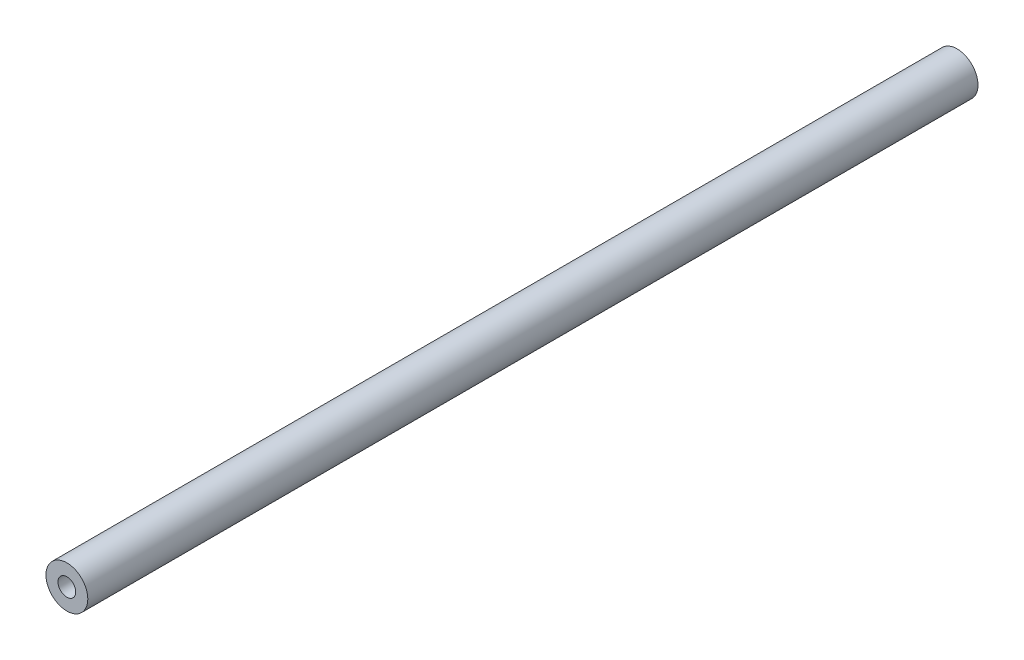
from build123d import *

# Parameters (mm, degrees)
SKETCH1_R                  = 4.7625
BOSS_EXTRUDE1_DEPTH        = 202.692
F_10_32_TAPPED_HOLE1_D     = 4.0386
F_10_32_TAPPED_HOLE1_DEPTH = 19.05
F_10_32_TAPPED_HOLE1_TIP   = 1.213317848
F_10_32_TAPPED_HOLE4_D     = 4.0386
F_10_32_TAPPED_HOLE4_DEPTH = 19.05
F_10_32_TAPPED_HOLE4_TIP   = 1.213317848


with BuildPart() as part:
    # Sketch1 → Boss-Extrude1 (new body)
    with BuildSketch(Plane.XY):
        Circle(SKETCH1_R)
    extrude(amount=-BOSS_EXTRUDE1_DEPTH)

    # #10-32 Tapped Hole1
    with Locations(Plane(origin=(0, 0, -202.692), x_dir=(-1, 0, 0), z_dir=(0, 0, -1))):
        with Locations((0, 0)):
            Hole(F_10_32_TAPPED_HOLE1_D / 2, depth=F_10_32_TAPPED_HOLE1_DEPTH)
            with Locations((0, 0, -(F_10_32_TAPPED_HOLE1_DEPTH + F_10_32_TAPPED_HOLE1_TIP / 2))):  # 118° drill point
                Cone(0, F_10_32_TAPPED_HOLE1_D / 2, F_10_32_TAPPED_HOLE1_TIP, mode=Mode.SUBTRACT)

    # #10-32 Tapped Hole4
    with Locations(Plane.XY):
        with Locations((0, 0)):
            Hole(F_10_32_TAPPED_HOLE4_D / 2, depth=F_10_32_TAPPED_HOLE4_DEPTH)
            with Locations((0, 0, -(F_10_32_TAPPED_HOLE4_DEPTH + F_10_32_TAPPED_HOLE4_TIP / 2))):  # 118° drill point
                Cone(0, F_10_32_TAPPED_HOLE4_D / 2, F_10_32_TAPPED_HOLE4_TIP, mode=Mode.SUBTRACT)


solid = part.part
